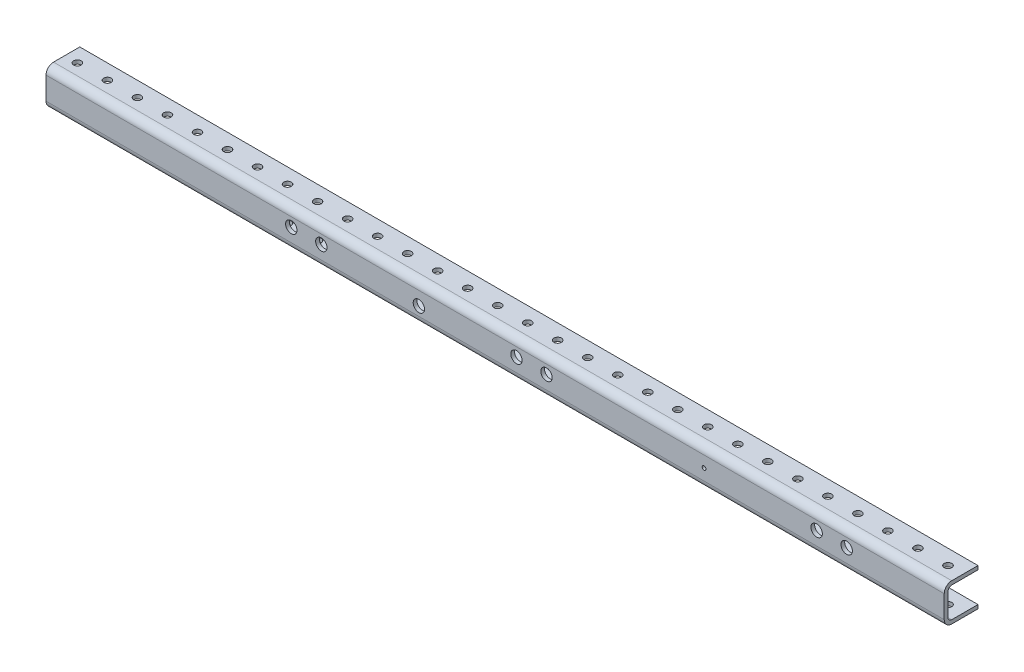
from build123d import *

# Parameters (mm, degrees)
SKETCH1_W          = 889
SKETCH1_H          = 31.75
EXTRUDE1_DEPTH     = 28.575
EXTRUDE2_REACH     = 891.702
SKETCH2_W          = 25.4
SKETCH2_H          = 25.4
HOLE1_D            = 6.35
HOLE1_DEPTH        = 3.175
LPATTERN1_COUNT    = 35
LPATTERN1_PITCH    = 25.4
HOLE2_D            = 9.652
LPATTERN2_COUNT    = 12
LPATTERN2_PITCH    = 25.4
HOLE3_D            = 9.652
HOLE4_D            = 9.652
LPATTERN3_COUNT    = 12
LPATTERN3_PITCH    = 25.4
HOLE5_D            = 3.175
HOLE6_D            = 6.35
LPATTERN4_COUNT    = 35
LPATTERN4_PITCH    = 25.4
FILLET1_R          = 3.175
FILLET2_R          = 3.175
FILLET3_R          = 6.35
FILLET4_R          = 6.35
SKETCH16_W         = 145.760071232
SKETCH16_H         = 71.504803879
CUT_EXTRUDE2_DEPTH = 75


with BuildPart() as part:
    # Sketch1 → Extrude1 (new body)
    with BuildSketch(Plane.XY.offset(3.175)):
        with Locations((428.480011997, 8.672957166)):
            Rectangle(SKETCH1_W, SKETCH1_H)
    extrude(amount=-EXTRUDE1_DEPTH)

    # Sketch2 → Extrude2 (cut, up to next)
    with BuildSketch(Plane.ZY.offset(16.019988003), mode=Mode.PRIVATE) as extrude2_sk1:
        with Locations((-12.7, 8.672957166)):
            Rectangle(SKETCH2_W, SKETCH2_H)
    extrude2_tool1 = extrude(extrude2_sk1.sketch, amount=-EXTRUDE2_REACH, mode=Mode.PRIVATE) & part.part
    add(extrude2_tool1.solids().sort_by_distance((-16.019988, 8.672957, -12.7))[0], mode=Mode.SUBTRACT)

    # Hole1
    with Locations(Plane(origin=(0, 24.547957166, 0), x_dir=(-1, 0, 0), z_dir=(0, 1, 0))):
        with Locations((3.319988003, -12.7)):
            hole1 = Hole(HOLE1_D / 2, depth=HOLE1_DEPTH)

    # LPattern1: Hole1 ×35
    with Locations(*[(i * LPATTERN1_PITCH, 0, 0) for i in range(1, LPATTERN1_COUNT)]):
        add(hole1, mode=Mode.SUBTRACT)

    # Hole2 (through all)
    with Locations(Plane.XY.offset(3.175)):
        with Locations((66.530011997, 10.577957166)):
            hole2 = Hole(HOLE2_D / 2)

    # LPattern2: Hole2 ×12, 8 skipped
    with Locations(*[(i * LPATTERN2_PITCH, 0, 0) for i in range(1, LPATTERN2_COUNT) if i not in (2, 3, 4, 5, 6, 7, 8, 9)]):
        add(hole2, mode=Mode.SUBTRACT)

    # Hole3 (through all)
    with Locations(Plane.XY.offset(3.175)):
        with Locations((428.480011997, 6.767957166)):
            Hole(HOLE3_D / 2)

    # Hole4 (through all)
    with Locations(Plane.XY.offset(3.175)):
        with Locations((511.030011997, 10.577957166)):
            hole4 = Hole(HOLE4_D / 2)

    # LPattern3: Hole4 ×12, 8 skipped
    with Locations(*[(i * LPATTERN3_PITCH, 0, 0) for i in range(1, LPATTERN3_COUNT) if i not in (2, 3, 4, 5, 6, 7, 8, 9)]):
        add(hole4, mode=Mode.SUBTRACT)

    # Hole5 (through all)
    with Locations(Plane.XY.offset(3.175)):
        with Locations((669.780011997, 8.672957166)):
            Hole(HOLE5_D / 2)

    # Hole6 (through all)
    with Locations(Plane(origin=(0, -4.027042834, 0), x_dir=(-1, 0, 0), z_dir=(0, 1, 0))):
        with Locations((3.319988003, -12.7)):
            hole6 = Hole(HOLE6_D / 2)

    # LPattern4: Hole6 ×35
    with Locations(*[(i * LPATTERN4_PITCH, 0, 0) for i in range(1, LPATTERN4_COUNT)]):
        add(hole6, mode=Mode.SUBTRACT)

    # Fillet1
    fillet1_edges = [part.edges().sort_by_distance(p)[0] for p in [
        (428.480011997, 21.372957166, 0),
    ]]
    fillet(fillet1_edges, radius=FILLET1_R)

    # Fillet2
    fillet2_edges = [part.edges().sort_by_distance(p)[0] for p in [
        (428.480011997, -4.027042834, 0),
    ]]
    fillet(fillet2_edges, radius=FILLET2_R)

    # Fillet3
    fillet3_edges = [part.edges().sort_by_distance(p)[0] for p in [
        (428.480011997, -7.202042834, 3.175),
    ]]
    fillet(fillet3_edges, radius=FILLET3_R)

    # Fillet4
    fillet4_edges = [part.edges().sort_by_distance(p)[0] for p in [
        (428.480011997, 24.547957166, 3.175),
    ]]
    fillet(fillet4_edges, radius=FILLET4_R)

    # Sketch16 → Cut-Extrude2 (cut)
    with BuildSketch(Plane(origin=(0, 24.547957166, 0), x_dir=(1, 0, 0), z_dir=(0, 1, 0))):
        with Locations((40.099976381, -10.352401939)):
            Rectangle(SKETCH16_W, SKETCH16_H)
    extrude(amount=-CUT_EXTRUDE2_DEPTH, mode=Mode.SUBTRACT)


solid = part.part
